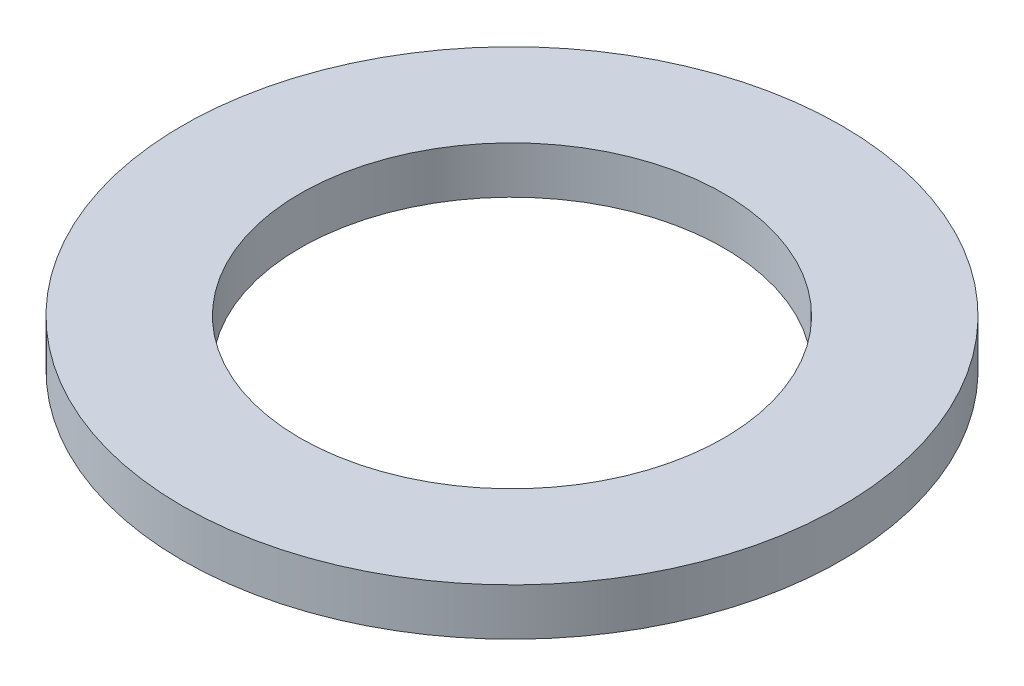
from build123d import *

# Parameters (mm, degrees)
SKETCH1_R           = 70
BOSS_EXTRUDE1_DEPTH = 10
SKETCH2_R           = 45
CUT_EXTRUDE1_DEPTH  = 100.498743711


with BuildPart() as part:
    # Sketch1 → Boss-Extrude1 (new body)
    with BuildSketch(Plane(origin=(0, 0, 0), x_dir=(1, 0, 0), z_dir=(0, 1, 0))):
        Circle(SKETCH1_R)
    extrude(amount=BOSS_EXTRUDE1_DEPTH)

    # Sketch2 → Cut-Extrude1 (cut, through all)
    with BuildSketch(Plane(origin=(0, 0, 0), x_dir=(1, 0, 0), z_dir=(0, 1, 0))):
        Circle(SKETCH2_R)
    extrude(amount=CUT_EXTRUDE1_DEPTH, mode=Mode.SUBTRACT)


solid = part.part
